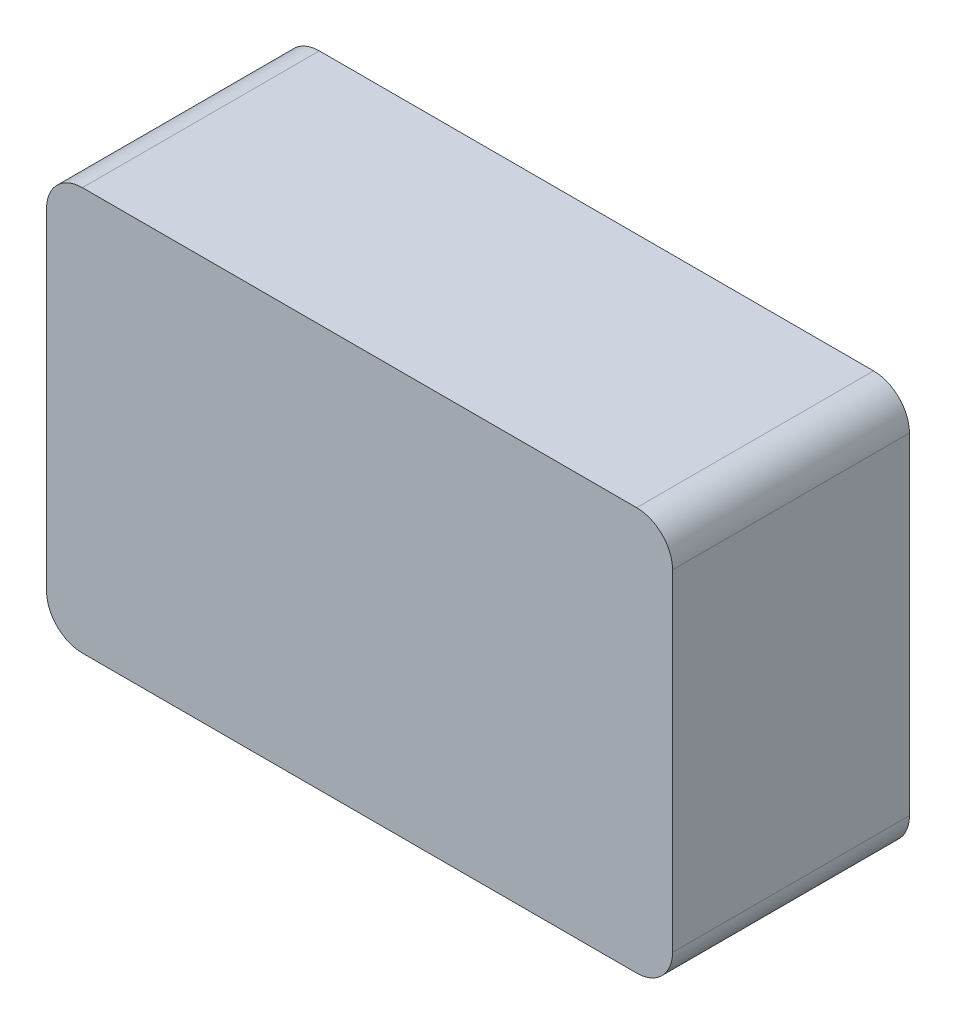
from build123d import *

# Parameters (mm, degrees)
BOSS_EXTRUDE1_DEPTH = 33


with BuildPart() as part:
    # Sketch1 → Boss-Extrude1 (new body)
    with BuildSketch(Plane.XY):
        with BuildLine():
            Line((-38.6, -28.075), (38.6, -28.075))
            ThreePointArc((38.6, -28.075), (42.135533906, -26.610533906), (43.6, -23.075))
            Line((43.6, -23.075), (43.6, 23.075))
            ThreePointArc((43.6, 23.075), (42.135533906, 26.610533906), (38.6, 28.075))
            Line((38.6, 28.075), (-38.6, 28.075))
            ThreePointArc((-38.6, 28.075), (-42.135533906, 26.610533906), (-43.6, 23.075))
            Line((-43.6, 23.075), (-43.6, -23.075))
            ThreePointArc((-43.6, -23.075), (-42.135533906, -26.610533906), (-38.6, -28.075))
        make_face()
    extrude(amount=BOSS_EXTRUDE1_DEPTH)


solid = part.part
